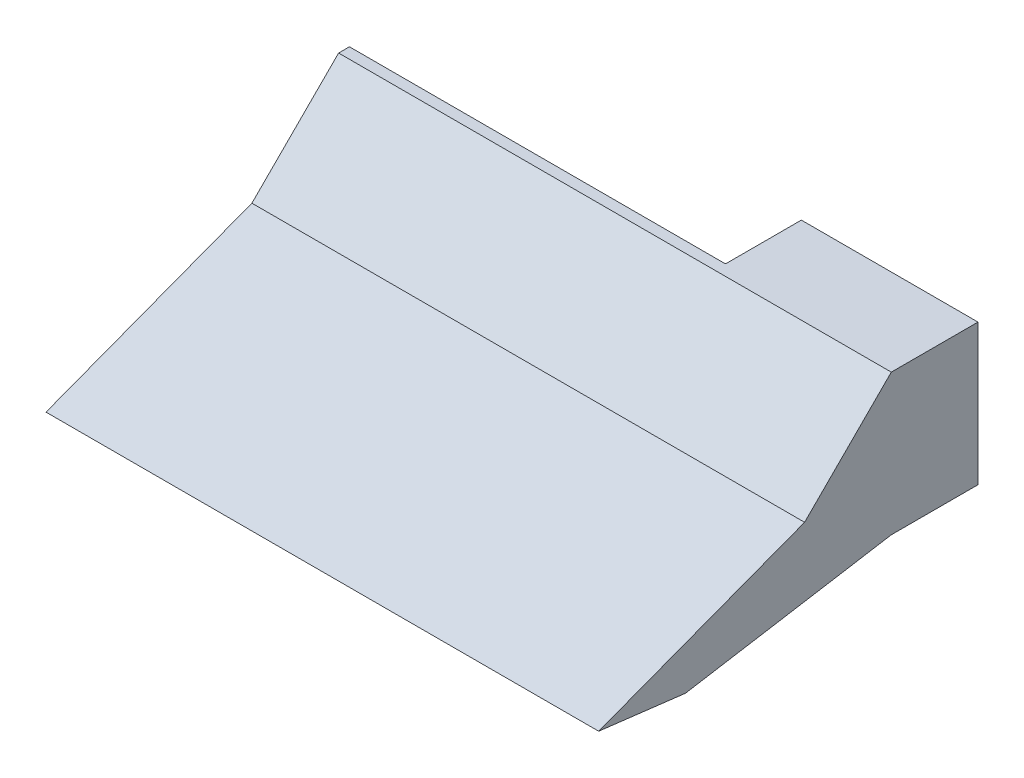
from build123d import *

# Parameters (mm, degrees)
SKETCH2_W           = 16.3
SKETCH2_H           = 13
SKETCH2_W_2         = 14.3
SKETCH2_H_2         = 11
BOSS_EXTRUDE1_DEPTH = 7
SKETCH3_W           = 51
SKETCH3_H           = 13
SKETCH3_W_2         = 14.3
SKETCH3_H_2         = 11
BOSS_EXTRUDE2_DEPTH = 1
BOSS_EXTRUDE3_DEPTH = 1
LPATTERN1_COUNT     = 2
LPATTERN1_PITCH     = 50
BOSS_EXTRUDE4_REACH = 63.794


with BuildPart() as part:
    # Sketch2 → Boss-Extrude1 (new body)
    with BuildSketch(Plane.XY):
        Rectangle(SKETCH2_W, SKETCH2_H)
        Rectangle(SKETCH2_W_2, SKETCH2_H_2, mode=Mode.SUBTRACT)
    extrude(amount=BOSS_EXTRUDE1_DEPTH)

    # Sketch3 → Boss-Extrude2 (add)
    with BuildSketch(Plane.XY.offset(7)):
        with Locations((17.35, 0)):
            Rectangle(SKETCH3_W, SKETCH3_H)
        Rectangle(SKETCH3_W_2, SKETCH3_H_2, mode=Mode.SUBTRACT)
    extrude(amount=BOSS_EXTRUDE2_DEPTH)

    # Sketch4 → Boss-Extrude3 (add)
    with BuildSketch(Plane.ZY.offset(8.15)):
        Polygon((8, 6.5), (16, -1.5), (27, -5.666666667), (35, -8.696969697), (27, -9.666666667), (14, -7.5), (8, -6.5), align=None)
    boss_extrude3 = extrude(amount=-BOSS_EXTRUDE3_DEPTH)

    # LPattern1: Boss-Extrude3 ×2
    with Locations(*[(i * LPATTERN1_PITCH, 0, 0) for i in range(1, LPATTERN1_COUNT)]):
        add(boss_extrude3)

    # Sketch5 → Boss-Extrude4 (add, up to next)
    with BuildSketch(Plane(origin=(-7.15, 0, 0), x_dir=(0, 0, -1), z_dir=(1, 0, 0)), mode=Mode.PRIVATE) as boss_extrude4_sk1:
        Polygon((-8, 5.5), (-16, -2.5), (-33, -8.939393939), (-35, -8.696969697), (-16, -1.5), (-8, 6.5), align=None)
    boss_extrude4_tool1 = extrude(boss_extrude4_sk1.sketch, amount=BOSS_EXTRUDE4_REACH, mode=Mode.PRIVATE) - part.part
    # Sketch5 → Boss-Extrude4 (add, up to next)
    with BuildSketch(Plane(origin=(-7.15, 0, 0), x_dir=(0, 0, -1), z_dir=(1, 0, 0)), mode=Mode.PRIVATE) as boss_extrude4_sk2:
        Polygon((-8, -5.5), (-27, -8.666666667), (-27, -9.666666667), (-8, -6.5), align=None)
    boss_extrude4_tool2 = extrude(boss_extrude4_sk2.sketch, amount=BOSS_EXTRUDE4_REACH, mode=Mode.PRIVATE) - part.part
    add(boss_extrude4_tool1.solids().sort_by_distance((-7.15, 1.719929, 12.219929))[0])
    add(boss_extrude4_tool2.solids().sort_by_distance((-7.15, -7.583333, 17.5))[0])


with BuildPart() as body_2:
    # Mirror2: mirrored copy
    add(part.part.mirror(Plane(origin=(-8.15, 6.5, 7), x_dir=(0, 0, 1), z_dir=(1, 0, 0))))


solid = body_2.part
